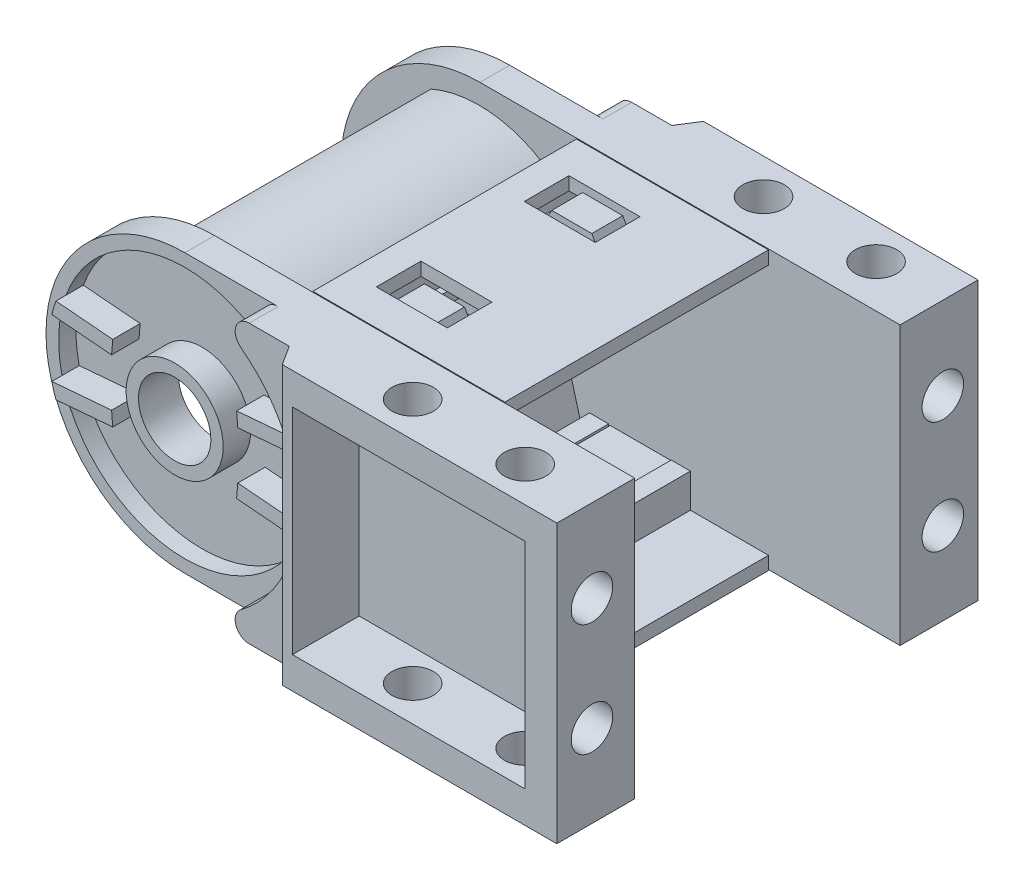
from build123d import *

# Parameters (mm, degrees)
BOSS_EXTRUDE1_START  = 29.95
BOSS_EXTRUDE1_DEPTH  = 11.08
SKETCH2_W            = 33.1
SKETCH2_H            = 30.5
CUT_EXTRUDE1_DEPTH   = 9.5
CUT_EXTRUDE2_DEPTH   = 2.75
CHAMFER1_SIZE2       = 1.75
CHAMFER1_SIZE        = 2.75
SKETCH20_R           = 20.15
CUT_EXTRUDE10_DEPTH  = 4.1
FILLET3_R            = 2
SKETCH21_R           = 17.95
CUT_EXTRUDE11_DEPTH  = 2.45
SKETCH22_R           = 5.15
CUT_EXTRUDE12_DEPTH  = 64.613009676
BOSS_EXTRUDE11_START = 3.9
SKETCH23_R           = 6.9
SKETCH23_R_2         = 5.15
BOSS_EXTRUDE11_DEPTH = 3.9
SKETCH6_R            = 2.95
CUT_EXTRUDE4_DEPTH   = 78.635784275
CUT_EXTRUDE5_REACH   = 89.22
SKETCH7_R            = 2.95
BOSS_EXTRUDE4_DEPTH  = 10.92
BOSS_EXTRUDE5_START  = -1.1
BOSS_EXTRUDE5_DEPTH  = 4.4
BOSS_EXTRUDE6_DEPTH  = 18.75
SKETCH15_W           = 10.1
SKETCH15_H           = 6.35
CUT_EXTRUDE9_DEPTH   = 5
BOSS_EXTRUDE7_REACH  = 76.451
SKETCH16_W           = 14.35
SKETCH16_H           = 2


with BuildPart() as part:
    # Sketch1 → Boss-Extrude1 (new body)
    with BuildSketch(Plane.XY.offset(BOSS_EXTRUDE1_START)):
        with BuildLine():
            Line((0, 19.75), (59.75, 19.75))
            Line((59.75, 19.75), (59.75, -19.75))
            Line((59.75, -19.75), (0, -19.75))
            ThreePointArc((0, -19.75), (-19.75, 0), (0, 19.75))
        make_face()
    extrude(amount=-BOSS_EXTRUDE1_DEPTH)

    # Sketch2 → Cut-Extrude1 (cut)
    with BuildSketch(Plane.XY.offset(29.95)):
        with Locations((38.7, 0)):
            Rectangle(SKETCH2_W, SKETCH2_H)
    extrude(amount=-CUT_EXTRUDE1_DEPTH, mode=Mode.SUBTRACT)

    # Sketch3 → Cut-Extrude2 (cut)
    with BuildSketch(Plane.XY.offset(29.95)):
        with BuildLine():
            Line((0, -19.75), (18.95, -19.75))
            Line((18.95, -19.75), (18.95, 19.75))
            Line((18.95, 19.75), (0, 19.75))
            ThreePointArc((0, 19.75), (-19.75, 0), (0, -19.75))
        make_face()
    extrude(amount=-CUT_EXTRUDE2_DEPTH, mode=Mode.SUBTRACT)

    # Chamfer1
    chamfer1_edges = [part.edges().sort_by_distance(p)[0] for p in [
        (18.95, 0, 29.95),
    ]]
    chamfer1_side = [part.faces().sort_by_distance(p)[0] for p in [
        (18.95, 0, 29.915),
    ]]
    chamfer(chamfer1_edges, length=CHAMFER1_SIZE - 0.0001, length2=CHAMFER1_SIZE2 - 0.0001, reference=chamfer1_side[0])  # a hair under: the kernel refuses the full size

    # Sketch20 → Cut-Extrude10 (cut)
    with BuildSketch(Plane.XY.offset(27.2)):
        Circle(SKETCH20_R)
    extrude(amount=-CUT_EXTRUDE10_DEPTH, mode=Mode.SUBTRACT)

    # Fillet3
    fillet3_edges = [part.edges().sort_by_distance(p)[0] for p in [
        (3.994996871, 19.75, 25.15),
        (3.994996871, -19.75, 25.15),
    ]]
    fillet(fillet3_edges, radius=FILLET3_R)

    # Sketch21 → Cut-Extrude11 (cut)
    with BuildSketch(Plane.XY.offset(23.1)):
        Circle(SKETCH21_R)
    extrude(amount=-CUT_EXTRUDE11_DEPTH, mode=Mode.SUBTRACT)

    # Sketch22 → Cut-Extrude12 (cut, through all)
    with BuildSketch(Plane.XY.offset(20.65)):
        Circle(SKETCH22_R)
    extrude(amount=-CUT_EXTRUDE12_DEPTH, mode=Mode.SUBTRACT)

    # Sketch23 → Boss-Extrude11 (add)
    # profile 1 of 5: a face of its own
    with BuildSketch(Plane.XY.offset(20.65).offset(BOSS_EXTRUDE11_START)):
        Circle(SKETCH23_R)
        Circle(SKETCH23_R_2, mode=Mode.SUBTRACT)
    # profile 2 of 5: a face of its own
    with BuildSketch(Plane.XY.offset(20.65).offset(BOSS_EXTRUDE11_START)):
        with BuildLine():
            Line((16.890733406, 6.075), (8.806513597, 5.4))
            Line((8.806513597, 5.4), (8.972926519, 3.40693534))
            Line((8.972926519, 3.40693534), (17.471594029, 4.116540064))
            ThreePointArc((17.471594029, 4.116540064), (17.2090464, 5.104039771), (16.890733406, 6.075))
        make_face()
    # profile 3 of 5: a face of its own
    with BuildSketch(Plane.XY.offset(20.65).offset(BOSS_EXTRUDE11_START)):
        with BuildLine():
            Line((17.471594029, -4.116540064), (8.972926519, -3.40693534))
            Line((8.972926519, -3.40693534), (8.806513597, -5.4))
            Line((8.806513597, -5.4), (16.890733406, -6.075))
            ThreePointArc((16.890733406, -6.075), (17.2090464, -5.104039771), (17.471594029, -4.116540064))
        make_face()
    # profile 4 of 5: a face of its own
    with BuildSketch(Plane.XY.offset(20.65).offset(BOSS_EXTRUDE11_START)):
        with BuildLine():
            Line((-8.806513597, -5.4), (-8.972926519, -3.40693534))
            Line((-8.972926519, -3.40693534), (-17.471594029, -4.116540064))
            ThreePointArc((-17.471594029, -4.116540064), (-17.2090464, -5.104039771), (-16.890733406, -6.075))
            Line((-16.890733406, -6.075), (-8.806513597, -5.4))
        make_face()
    # profile 5 of 5: a face of its own
    with BuildSketch(Plane.XY.offset(20.65).offset(BOSS_EXTRUDE11_START)):
        with BuildLine():
            Line((-17.471594029, 4.116540064), (-8.972926519, 3.40693534))
            Line((-8.972926519, 3.40693534), (-8.806513597, 5.4))
            Line((-8.806513597, 5.4), (-16.890733406, 6.075))
            ThreePointArc((-16.890733406, 6.075), (-17.2090464, 5.104039771), (-17.471594029, 4.116540064))
        make_face()
    extrude(amount=-BOSS_EXTRUDE11_DEPTH)

    # Sketch6 → Cut-Extrude4 (cut, through all)
    with BuildSketch(Plane(origin=(0, 19.75, 0), x_dir=(1, 0, 0), z_dir=(0, 1, 0))):
        with Locations(Location((50.25, -24.95, 0), (0, 0, 270))):
            Circle(SKETCH6_R)
        with Locations(Location((34.25, -24.95, 0), (0, 0, 270))):
            Circle(SKETCH6_R)
    extrude(amount=-CUT_EXTRUDE4_DEPTH, mode=Mode.SUBTRACT)

    # Sketch7 → Cut-Extrude5 (cut, up to next)
    with BuildSketch(Plane(origin=(59.75, 0, 0), x_dir=(0, 0, -1), z_dir=(1, 0, 0)), mode=Mode.PRIVATE) as cut_extrude5_sk1:
        with Locations((-24.95, 8)):
            Circle(SKETCH7_R)
    cut_extrude5_tool1 = extrude(cut_extrude5_sk1.sketch, amount=-CUT_EXTRUDE5_REACH, mode=Mode.PRIVATE) & part.part
    # Sketch7 → Cut-Extrude5 (cut, up to next)
    with BuildSketch(Plane(origin=(59.75, 0, 0), x_dir=(0, 0, -1), z_dir=(1, 0, 0)), mode=Mode.PRIVATE) as cut_extrude5_sk2:
        with Locations((-24.95, -8)):
            Circle(SKETCH7_R)
    cut_extrude5_tool2 = extrude(cut_extrude5_sk2.sketch, amount=-CUT_EXTRUDE5_REACH, mode=Mode.PRIVATE) & part.part
    add(cut_extrude5_tool1.solids().sort_by_distance((59.75, 8, 24.95))[0], mode=Mode.SUBTRACT)
    add(cut_extrude5_tool2.solids().sort_by_distance((59.75, -8, 24.95))[0], mode=Mode.SUBTRACT)

    # Sketch12 → Boss-Extrude4 (add)
    with BuildSketch(Plane(origin=(0, 0, 18.87), x_dir=(-1, 0, 0), z_dir=(0, 0, -1))):
        Polygon((-27.425, 17.15), (-18.325, 17.15), (-17.5, 15.65), (-17.5, 14.85), (-18.525, 14.85), (-18.525, 13.25), (-27.225, 13.25), (-27.225, 14.85), (-28.25, 14.85), (-28.25, 15.65), align=None)
        Polygon((-17.5, -15.65), (-17.5, -14.85), (-18.525, -14.85), (-18.525, -13.25), (-27.225, -13.25), (-27.225, -14.85), (-28.25, -14.85), (-28.25, -15.65), (-27.425, -17.15), (-18.325, -17.15), align=None)
    extrude(amount=BOSS_EXTRUDE4_DEPTH)

    # Sketch13 → Boss-Extrude5 (add)
    with BuildSketch(Plane(origin=(0, 0, 7.95), x_dir=(-1, 0, 0), z_dir=(0, 0, -1)).offset(BOSS_EXTRUDE5_START)):
        Polygon((-26.7, 17.15), (-25.725, 18.9), (-20.025, 18.9), (-19.05, 17.15), align=None)
        Polygon((-20.025, -18.9), (-19.05, -17.15), (-26.7, -17.15), (-25.725, -18.9), align=None)
    extrude(amount=-BOSS_EXTRUDE5_DEPTH)


with BuildPart() as body_2:
    # Sketch14 → Boss-Extrude6 (new, symmetric)
    with BuildSketch(Plane.XY):
        with BuildLine():
            Line((41.15, 19.75), (13.85, 19.75))
            Line((13.85, 19.75), (11.787175234, 12.25))
            ThreePointArc((11.787175234, 12.25), (2.971704939, 16.738248706), (-6.85, 15.558839931))
            Line((-6.85, 15.558839931), (-6.092470588, 13.83821528))
            ThreePointArc((-6.092470588, 13.83821528), (4.294757816, 14.497222331), (12.646917657, 8.286728775))
            Line((12.646917657, 8.286728775), (15.28273222, 17.87))
            Line((15.28273222, 17.87), (15.7, 17.87))
            Line((15.7, 17.87), (15.7, 13.05))
            Line((15.7, 13.05), (18.425, 13.05))
            Line((18.425, 13.05), (18.425, 14.75))
            Line((18.425, 14.75), (17.4, 14.75))
            Line((17.4, 14.75), (17.4, 17.87))
            Line((17.4, 17.87), (28.35, 17.87))
            Line((28.35, 17.87), (28.35, 14.75))
            Line((28.35, 14.75), (27.325, 14.75))
            Line((27.325, 14.75), (27.325, 13.05))
            Line((27.325, 13.05), (30.05, 13.05))
            Line((30.05, 13.05), (30.05, 17.87))
            Line((30.05, 17.87), (41.15, 17.87))
            Line((41.15, 17.87), (41.15, 19.75))
        make_face()
    extrude(amount=BOSS_EXTRUDE6_DEPTH, both=True)

    # Sketch15 → Cut-Extrude9 (cut)
    with BuildSketch(Plane(origin=(0, 19.75, 0), x_dir=(1, 0, 0), z_dir=(0, 1, 0))):
        with Locations((22.875, -10.525)):
            Rectangle(SKETCH15_W, SKETCH15_H)
        with Locations((22.875, 10.525)):
            Rectangle(SKETCH15_W, SKETCH15_H)
    extrude(amount=-CUT_EXTRUDE9_DEPTH, mode=Mode.SUBTRACT)

    # Boss-Extrude7: up to this face of the body (flat: up to its plane)
    boss_extrude7_end = Plane(body_2.part.faces().sort_by_distance((35.6, 17.87, 0))[0])
    # Sketch16 → Boss-Extrude7 (add, up to the picked face)
    with BuildSketch(Plane.XZ.offset(-13.05), mode=Mode.PRIVATE) as boss_extrude7_sk1:
        with Locations((22.875, 0)):
            Rectangle(SKETCH16_W, SKETCH16_H)
    boss_extrude7_tool1 = split(extrude(boss_extrude7_sk1.sketch, amount=-BOSS_EXTRUDE7_REACH, mode=Mode.PRIVATE), bisect_by=boss_extrude7_end, keep=Keep.BOTH, mode=Mode.PRIVATE)
    add(boss_extrude7_tool1.solids().sort_by(Axis((22.875, 13.05, 0), (0, 1, 0)))[0])


with BuildPart() as body_3:
    # Mirror1: mirrored copy
    add(part.part.mirror(Plane.XY))


with BuildPart() as body_4:
    # Mirror2: mirrored copy
    add(body_2.part.mirror(Plane.ZX))


solid = Compound([part.part, body_2.part, body_3.part, body_4.part])
